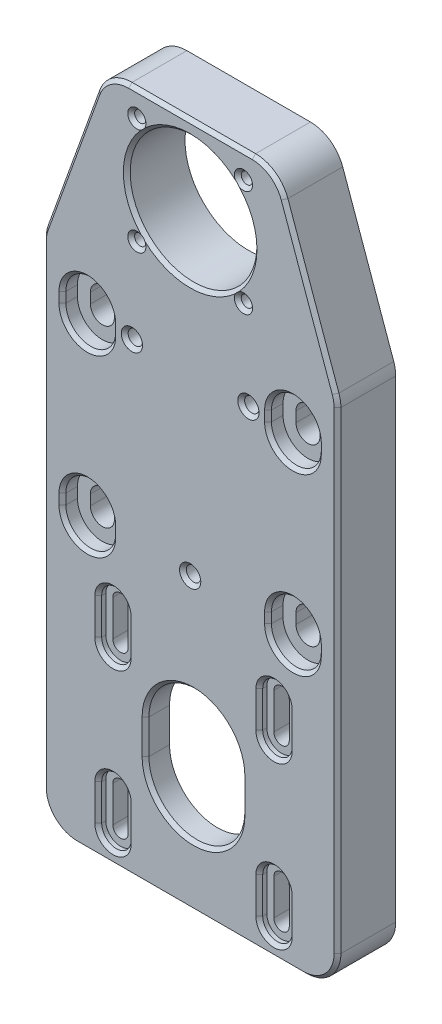
from build123d import *

# Parameters (mm, degrees)
SKETCH1_R                                = 18.5
SKETCH1_W                                = 86
SKETCH1_H                                = 77
SKETCH1_H_2                              = 72.733642247
BOSS_EXTRUDE1_DEPTH                      = 17
M4X0_7_TAPPED_HOLE1_D                    = 3.3
M4X0_7_TAPPED_HOLE1_DEPTH                = 20
M4X0_7_TAPPED_HOLE1_TIP                  = 0.991420021
CBORE_SLOT_FOR_M4_SBHCS3_DEPTH           = 17
CBORE_START                              = 14.8
CBORE_SLOT_FOR_M4_SBHCS3_2_DEPTH         = 2.2
CUT_EXTRUDE1_DEPTH                       = 138.03649149
CBORE_SLOT_FOR_M6_HEX_HEAD_BOLT1_DEPTH   = 17
CBORE_START_2                            = 12.62
CBORE_SLOT_FOR_M6_HEX_HEAD_BOLT1_2_DEPTH = 4.38
FILLET1_R                                = 10
CUT_EXTRUDE2_DEPTH                       = 10
SKETCH22_R                               = 2.1
CUT_EXTRUDE3_DEPTH                       = 138.03649149
CHAMFER1_SIZE                            = 1


# Read off the part's stored shape, not the designer's step: CBORE SLOT for M4 SBHCS3, CBORE SLOT for M6 Hex Head Bolt1
with BuildPart() as part:
    # Sketch1 → Boss-Extrude1 (new body)
    # profile 1 of 3: a face of its own
    with BuildSketch(Plane.XY):
        Polygon((14.773286703, 129), (-14.773286703, 129), (-24.97132573, 129), (-43, 79), (43, 79), (25.15845151, 129), (20.15845151, 129), align=None)
        with Locations((0, 106)):
            Circle(SKETCH1_R, mode=Mode.SUBTRACT)
    # profile 2 of 3: a face of its own
    with BuildSketch(Plane.XY):
        with Locations((0, 40.5)):
            Rectangle(SKETCH1_W, SKETCH1_H)
    # profile 3 of 3: a face of its own
    with BuildSketch(Plane.XY):
        with Locations((0, -34.366821124)):
            Rectangle(SKETCH1_W, SKETCH1_H_2)
    extrude(amount=BOSS_EXTRUDE1_DEPTH)

    # M4x0.7 Tapped Hole1
    with Locations(Plane(origin=(-15.556349182, 90.443650818, 17), x_dir=(1, 0, 0), z_dir=(0, 0, 1))):
        with Locations((0, 0), (0, 31.112698364), (31.112698364, 31.112698364), (31.112698364, 0)):
            Hole(M4X0_7_TAPPED_HOLE1_D / 2, depth=M4X0_7_TAPPED_HOLE1_DEPTH)
            with Locations((0, 0, -(M4X0_7_TAPPED_HOLE1_DEPTH + M4X0_7_TAPPED_HOLE1_TIP / 2))):  # 118° drill point
                Cone(0, M4X0_7_TAPPED_HOLE1_D / 2, M4X0_7_TAPPED_HOLE1_TIP, mode=Mode.SUBTRACT)

    # CBORE SLOT for M4 SBHCS3 outline → CBORE SLOT for M4 SBHCS3 (cut)
    with BuildSketch(Plane.XY):
        with BuildLine():
            ThreePointArc((-20.274967442, -52.200025), (-22.524967442, -49.950025), (-24.774967442, -52.200025))
            Line((-24.774967442, -52.200025), (-24.774967442, -62.700025))
            ThreePointArc((-24.774967442, -62.700025), (-22.524967442, -64.950025), (-20.274967442, -62.700025))
            Line((-20.274967442, -62.700025), (-20.274967442, -52.200025))
        make_face()
        with BuildLine():
            ThreePointArc((-20.274967442, -5.200025), (-22.524967442, -2.950025), (-24.774967442, -5.200025))
            Line((-24.774967442, -5.200025), (-24.774967442, -15.700025))
            ThreePointArc((-24.774967442, -15.700025), (-22.524967442, -17.950025), (-20.274967442, -15.700025))
            Line((-20.274967442, -15.700025), (-20.274967442, -5.200025))
        make_face()
        with BuildLine():
            ThreePointArc((22.225032558, -62.700025), (24.475032558, -64.950025), (26.725032558, -62.700025))
            Line((26.725032558, -62.700025), (26.725032558, -52.200025))
            ThreePointArc((26.725032558, -52.200025), (24.475032558, -49.950025), (22.225032558, -52.200025))
            Line((22.225032558, -52.200025), (22.225032558, -62.700025))
        make_face()
        with BuildLine():
            ThreePointArc((22.225032558, -15.700025), (24.475032558, -17.950025), (26.725032558, -15.700025))
            Line((26.725032558, -15.700025), (26.725032558, -5.200025))
            ThreePointArc((26.725032558, -5.200025), (24.475032558, -2.950025), (22.225032558, -5.200025))
            Line((22.225032558, -5.200025), (22.225032558, -15.700025))
        make_face()
    extrude(amount=CBORE_SLOT_FOR_M4_SBHCS3_DEPTH, mode=Mode.SUBTRACT)

    # CBORE SLOT for M4 SBHCS3 2 outline → CBORE SLOT for M4 SBHCS3 2 (cut)
    # profile 1 of 4: a face of its own
    with BuildSketch(Plane.XY.offset(CBORE_START)):
        with BuildLine():
            Line((-18.224967442, -62.700025), (-18.224967442, -52.200025))
            ThreePointArc((-18.224967442, -52.200025), (-22.524967442, -47.900025), (-26.824967442, -52.200025))
            Line((-26.824967442, -52.200025), (-26.824967442, -62.700025))
            ThreePointArc((-26.824967442, -62.700025), (-22.524967442, -67.000025), (-18.224967442, -62.700025))
        make_face()
        with BuildLine():
            Line((-24.774967442, -62.700025), (-24.774967442, -52.200025))
            ThreePointArc((-24.774967442, -52.200025), (-22.524967442, -49.950025), (-20.274967442, -52.200025))
            Line((-20.274967442, -52.200025), (-20.274967442, -62.700025))
            ThreePointArc((-20.274967442, -62.700025), (-22.524967442, -64.950025), (-24.774967442, -62.700025))
        make_face(mode=Mode.SUBTRACT)
    # profile 2 of 4: a face of its own
    with BuildSketch(Plane.XY.offset(CBORE_START)):
        with BuildLine():
            ThreePointArc((-18.224967442, -5.200025), (-22.524967442, -0.900025), (-26.824967442, -5.200025))
            Line((-26.824967442, -5.200025), (-26.824967442, -15.700025))
            ThreePointArc((-26.824967442, -15.700025), (-22.524967442, -20.000025), (-18.224967442, -15.700025))
            Line((-18.224967442, -15.700025), (-18.224967442, -5.200025))
        make_face()
        with BuildLine():
            Line((-24.774967442, -15.700025), (-24.774967442, -5.200025))
            ThreePointArc((-24.774967442, -5.200025), (-22.524967442, -2.950025), (-20.274967442, -5.200025))
            Line((-20.274967442, -5.200025), (-20.274967442, -15.700025))
            ThreePointArc((-20.274967442, -15.700025), (-22.524967442, -17.950025), (-24.774967442, -15.700025))
        make_face(mode=Mode.SUBTRACT)
    # profile 3 of 4: a face of its own
    with BuildSketch(Plane.XY.offset(CBORE_START)):
        with BuildLine():
            Line((28.775032558, -62.700025), (28.775032558, -52.200025))
            ThreePointArc((28.775032558, -52.200025), (24.475032558, -47.900025), (20.175032558, -52.200025))
            Line((20.175032558, -52.200025), (20.175032558, -62.700025))
            ThreePointArc((20.175032558, -62.700025), (24.475032558, -67.000025), (28.775032558, -62.700025))
        make_face()
        with BuildLine():
            Line((26.725032558, -52.200025), (26.725032558, -62.700025))
            ThreePointArc((26.725032558, -62.700025), (24.475032558, -64.950025), (22.225032558, -62.700025))
            Line((22.225032558, -62.700025), (22.225032558, -52.200025))
            ThreePointArc((22.225032558, -52.200025), (24.475032558, -49.950025), (26.725032558, -52.200025))
        make_face(mode=Mode.SUBTRACT)
    # profile 4 of 4: a face of its own
    with BuildSketch(Plane.XY.offset(CBORE_START)):
        with BuildLine():
            ThreePointArc((28.775032558, -5.200025), (24.475032558, -0.900025), (20.175032558, -5.200025))
            Line((20.175032558, -5.200025), (20.175032558, -15.700025))
            ThreePointArc((20.175032558, -15.700025), (24.475032558, -20.000025), (28.775032558, -15.700025))
            Line((28.775032558, -15.700025), (28.775032558, -5.200025))
        make_face()
        with BuildLine():
            Line((26.725032558, -5.200025), (26.725032558, -15.700025))
            ThreePointArc((26.725032558, -15.700025), (24.475032558, -17.950025), (22.225032558, -15.700025))
            Line((22.225032558, -15.700025), (22.225032558, -5.200025))
            ThreePointArc((22.225032558, -5.200025), (24.475032558, -2.950025), (26.725032558, -5.200025))
        make_face(mode=Mode.SUBTRACT)
    extrude(amount=CBORE_SLOT_FOR_M4_SBHCS3_2_DEPTH, mode=Mode.SUBTRACT)

    # Sketch13 → Cut-Extrude1 (cut, through all)
    with BuildSketch(Plane.XY.offset(17)):
        with BuildLine():
            Line((14.975032558, -28.950025), (14.975032558, -38.950025))
            ThreePointArc((14.975032558, -38.950025), (0.975032558, -52.950025), (-13.024967442, -38.950025))
            Line((-13.024967442, -38.950025), (-13.024967442, -28.950025))
            ThreePointArc((-13.024967442, -28.950025), (0.975032558, -14.950025), (14.975032558, -28.950025))
        make_face()
    extrude(amount=-CUT_EXTRUDE1_DEPTH, mode=Mode.SUBTRACT)

    # CBORE SLOT for M6 Hex Head Bolt1 outline → CBORE SLOT for M6 Hex Head Bolt1 (cut)
    with BuildSketch(Plane.XY):
        with BuildLine():
            ThreePointArc((33.5, 15.5), (30, 19), (26.5, 15.5))
            Line((26.5, 15.5), (26.5, 12.5))
            ThreePointArc((26.5, 12.5), (30, 9), (33.5, 12.5))
            Line((33.5, 12.5), (33.5, 15.5))
        make_face()
        with BuildLine():
            ThreePointArc((33.5, 66.5), (30, 70), (26.5, 66.5))
            Line((26.5, 66.5), (26.5, 63.5))
            ThreePointArc((26.5, 63.5), (30, 60), (33.5, 63.5))
            Line((33.5, 63.5), (33.5, 66.5))
        make_face()
        with BuildLine():
            ThreePointArc((-26.5, 15.5), (-30, 19), (-33.5, 15.5))
            Line((-33.5, 15.5), (-33.5, 12.5))
            ThreePointArc((-33.5, 12.5), (-30, 9), (-26.5, 12.5))
            Line((-26.5, 12.5), (-26.5, 15.5))
        make_face()
        with BuildLine():
            ThreePointArc((-26.5, 66.5), (-30, 70), (-33.5, 66.5))
            Line((-33.5, 66.5), (-33.5, 63.5))
            ThreePointArc((-33.5, 63.5), (-30, 60), (-26.5, 63.5))
            Line((-26.5, 63.5), (-26.5, 66.5))
        make_face()
    extrude(amount=CBORE_SLOT_FOR_M6_HEX_HEAD_BOLT1_DEPTH, mode=Mode.SUBTRACT)

    # CBORE SLOT for M6 Hex Head Bolt1 2 outli → CBORE SLOT for M6 Hex Head Bolt1 2 (cut)
    # profile 1 of 4: a face of its own
    with BuildSketch(Plane.XY.offset(CBORE_START_2)):
        with BuildLine():
            Line((37.275, 12.5), (37.275, 15.5))
            ThreePointArc((37.275, 15.5), (30, 22.775), (22.725, 15.5))
            Line((22.725, 15.5), (22.725, 12.5))
            ThreePointArc((22.725, 12.5), (30, 5.225), (37.275, 12.5))
        make_face()
        with BuildLine():
            Line((26.5, 12.5), (26.5, 15.5))
            ThreePointArc((26.5, 15.5), (30, 19), (33.5, 15.5))
            Line((33.5, 15.5), (33.5, 12.5))
            ThreePointArc((33.5, 12.5), (30, 9), (26.5, 12.5))
        make_face(mode=Mode.SUBTRACT)
    # profile 2 of 4: a face of its own
    with BuildSketch(Plane.XY.offset(CBORE_START_2)):
        with BuildLine():
            ThreePointArc((37.275, 66.5), (30, 73.775), (22.725, 66.5))
            Line((22.725, 66.5), (22.725, 63.5))
            ThreePointArc((22.725, 63.5), (30, 56.225), (37.275, 63.5))
            Line((37.275, 63.5), (37.275, 66.5))
        make_face()
        with BuildLine():
            Line((26.5, 63.5), (26.5, 66.5))
            ThreePointArc((26.5, 66.5), (30, 70), (33.5, 66.5))
            Line((33.5, 66.5), (33.5, 63.5))
            ThreePointArc((33.5, 63.5), (30, 60), (26.5, 63.5))
        make_face(mode=Mode.SUBTRACT)
    # profile 3 of 4: a face of its own
    with BuildSketch(Plane.XY.offset(CBORE_START_2)):
        with BuildLine():
            Line((-22.725, 12.5), (-22.725, 15.5))
            ThreePointArc((-22.725, 15.5), (-30, 22.775), (-37.275, 15.5))
            Line((-37.275, 15.5), (-37.275, 12.5))
            ThreePointArc((-37.275, 12.5), (-30, 5.225), (-22.725, 12.5))
        make_face()
        with BuildLine():
            Line((-33.5, 12.5), (-33.5, 15.5))
            ThreePointArc((-33.5, 15.5), (-30, 19), (-26.5, 15.5))
            Line((-26.5, 15.5), (-26.5, 12.5))
            ThreePointArc((-26.5, 12.5), (-30, 9), (-33.5, 12.5))
        make_face(mode=Mode.SUBTRACT)
    # profile 4 of 4: a face of its own
    with BuildSketch(Plane.XY.offset(CBORE_START_2)):
        with BuildLine():
            ThreePointArc((-22.725, 66.5), (-30, 73.775), (-37.275, 66.5))
            Line((-37.275, 66.5), (-37.275, 63.5))
            ThreePointArc((-37.275, 63.5), (-30, 56.225), (-22.725, 63.5))
            Line((-22.725, 63.5), (-22.725, 66.5))
        make_face()
        with BuildLine():
            Line((-33.5, 63.5), (-33.5, 66.5))
            ThreePointArc((-33.5, 66.5), (-30, 70), (-26.5, 66.5))
            Line((-26.5, 66.5), (-26.5, 63.5))
            ThreePointArc((-26.5, 63.5), (-30, 60), (-33.5, 63.5))
        make_face(mode=Mode.SUBTRACT)
    extrude(amount=CBORE_SLOT_FOR_M6_HEX_HEAD_BOLT1_2_DEPTH, mode=Mode.SUBTRACT)

    # Fillet1
    fillet1_edges = [part.edges().sort_by_distance(p)[0] for p in [
        (-43, 79, 8.5),
        (-24.97132573, 129, 8.5),
        (25.15845151, 129, 8.5),
        (43, 79, 8.5),
        (43, -70.733642247, 8.5),
        (-43, -70.733642247, 8.5),
    ]]
    fillet(fillet1_edges, radius=FILLET1_R)

    # Sketch21 → Cut-Extrude2 (cut)
    with BuildSketch(Plane(origin=(0, 0, 0), x_dir=(-1, 0, 0), z_dir=(0, 0, -1))):
        with BuildLine():
            Line((-31.475032558, -1.050025), (-31.475032558, -8.950025))
            Line((-31.475032558, -8.950025), (-31.475032558, -58.950025))
            Line((-31.475032558, -58.950025), (-31.475032558, -66.850025))
            ThreePointArc((-31.475032558, -66.850025), (-30.859956799, -68.33494924), (-29.375032558, -68.950025))
            Line((-29.375032558, -68.950025), (27.424967442, -68.950025))
            ThreePointArc((27.424967442, -68.950025), (28.909891682, -68.33494924), (29.524967442, -66.850025))
            Line((29.524967442, -66.850025), (29.524967442, -58.950025))
            Line((29.524967442, -58.950025), (29.524967442, -8.950025))
            Line((29.524967442, -8.950025), (29.524967442, -1.050025))
            ThreePointArc((29.524967442, -1.050025), (28.909891682, 0.43489924), (27.424967442, 1.049975))
            Line((27.424967442, 1.049975), (-29.375032558, 1.049975))
            ThreePointArc((-29.375032558, 1.049975), (-30.859956799, 0.43489924), (-31.475032558, -1.050025))
        make_face()
    extrude(amount=-CUT_EXTRUDE2_DEPTH, mode=Mode.SUBTRACT)

    # Sketch22 → Cut-Extrude3 (cut, through all)
    with BuildSketch(Plane.XY.offset(17)):
        with Locations((0, 13.760699385)):
            Circle(SKETCH22_R)
        with Locations((-17, 65)):
            Circle(SKETCH22_R)
        with Locations((17, 65)):
            Circle(SKETCH22_R)
    extrude(amount=-CUT_EXTRUDE3_DEPTH, mode=Mode.SUBTRACT)

    # Chamfer1
    # the kernel refuses this chamfer: 1 mm, written as the material it takes off along each edge
    with BuildSketch(Plane(origin=(28.775032558, -15.700025, 17), x_dir=(0.9996219169112968, 0, 0.027495876610585647), z_dir=(0, 1, 0)), Plane(origin=(20.175032558, -5.200025, 17), x_dir=(-0.9996219169112968, 0, 0.027495876610585647), z_dir=(0, -1, 0)), Plane(origin=(-18.224967442, -15.700025, 17), x_dir=(0.9996219169112968, 0, 0.027495876610585647), z_dir=(0, 1, 0)), Plane(origin=(-26.824967442, -5.200025, 17), x_dir=(-0.9996219169112968, 0, 0.027495876610585647), z_dir=(0, -1, 0)), Plane(origin=(-18.224967442, -62.700025, 17), x_dir=(0.9996219169112968, 0, 0.027495876610585647), z_dir=(0, 1, 0)), Plane(origin=(-26.824967442, -52.200025, 17), x_dir=(-0.9996219169112968, 0, 0.027495876610585647), z_dir=(0, -1, 0)), Plane(origin=(28.775032558, -62.700025, 17), x_dir=(0.9996219169112968, 0, 0.027495876610585647), z_dir=(0, 1, 0)), Plane(origin=(20.175032558, -52.200025, 17), x_dir=(-0.9996219169112968, 0, 0.027495876610585647), z_dir=(0, -1, 0))) as chamfer1_piece_1:
        Polygon((CHAMFER1_SIZE * 0.999621916911, CHAMFER1_SIZE * 0.0274958766106), (-CHAMFER1_SIZE * 0.0274958766106, CHAMFER1_SIZE * 0.999621916911), (0, 0), align=None)
    extrude(amount=10.5, mode=Mode.SUBTRACT)
    with BuildSketch(Plane(origin=(24.475032558, -5.200025, 17), x_dir=(1, 0, 0), z_dir=(0, -1, 0))) as chamfer1_piece_2:
        Polygon((4.3 + CHAMFER1_SIZE, 0), (4.3, -CHAMFER1_SIZE), (4.3, 0), align=None)
    revolve(axis=Axis((24.475032558, -5.200025, 17), (0, 0, 1)), revolution_arc=180, mode=Mode.SUBTRACT)
    with BuildSketch(Plane(origin=(24.475032558, -15.700025, 17), x_dir=(-1, 0, 0), z_dir=(0, 1, 0))) as chamfer1_piece_3:
        Polygon((4.3 + CHAMFER1_SIZE, 0), (4.3, -CHAMFER1_SIZE), (4.3, 0), align=None)
    revolve(axis=Axis((24.475032558, -15.700025, 17), (0, 0, 1)), revolution_arc=180, mode=Mode.SUBTRACT)
    with BuildSketch(Plane(origin=(-22.524967442, -5.200025, 17), x_dir=(1, 0, 0), z_dir=(0, -1, 0))) as chamfer1_piece_4:
        Polygon((4.3 + CHAMFER1_SIZE, 0), (4.3, -CHAMFER1_SIZE), (4.3, 0), align=None)
    revolve(axis=Axis((-22.524967442, -5.200025, 17), (0, 0, 1)), revolution_arc=180, mode=Mode.SUBTRACT)
    with BuildSketch(Plane(origin=(-22.524967442, -15.700025, 17), x_dir=(-1, 0, 0), z_dir=(0, 1, 0))) as chamfer1_piece_5:
        Polygon((4.3 + CHAMFER1_SIZE, 0), (4.3, -CHAMFER1_SIZE), (4.3, 0), align=None)
    revolve(axis=Axis((-22.524967442, -15.700025, 17), (0, 0, 1)), revolution_arc=180, mode=Mode.SUBTRACT)
    with BuildSketch(Plane(origin=(0.975032558, -28.950025, 17), x_dir=(-1, 0, 0), z_dir=(0, -1, 0))) as chamfer1_piece_6:
        Polygon((14 + CHAMFER1_SIZE, 0), (14, CHAMFER1_SIZE), (14, 0), align=None)
    revolve(axis=Axis((0.975032558, -28.950025, 17), (0, 0, -1)), revolution_arc=180, mode=Mode.SUBTRACT)
    with BuildSketch(Plane(origin=(-13.024967442, -38.950025, 17), x_dir=(-0.9996219169112968, 0, 0.027495876610585647), z_dir=(0, 1, 0)), Plane(origin=(14.975032558, -28.950025, 17), x_dir=(0.9996219169112968, 0, 0.027495876610585647), z_dir=(0, -1, 0))) as chamfer1_piece_7:
        Polygon((CHAMFER1_SIZE * 0.999621916911, -CHAMFER1_SIZE * 0.0274958766106), (-CHAMFER1_SIZE * 0.0274958766106, -CHAMFER1_SIZE * 0.999621916911), (0, 0), align=None)
    extrude(amount=10, mode=Mode.SUBTRACT)
    with BuildSketch(Plane(origin=(0.975032558, -38.950025, 17), x_dir=(1, 0, 0), z_dir=(0, 1, 0))) as chamfer1_piece_8:
        Polygon((14 + CHAMFER1_SIZE, 0), (14, CHAMFER1_SIZE), (14, 0), align=None)
    revolve(axis=Axis((0.975032558, -38.950025, 17), (0, 0, -1)), revolution_arc=180, mode=Mode.SUBTRACT)
    with BuildSketch(Plane(origin=(37.275, 12.5, 17), x_dir=(0.9996219169112968, 0, 0.02749587661058555), z_dir=(0, 1, 0)), Plane(origin=(22.725, 15.5, 17), x_dir=(-0.9996219169112968, 0, 0.027495876610585647), z_dir=(0, -1, 0)), Plane(origin=(-22.725, 12.5, 17), x_dir=(0.9996219169112968, 0, 0.027495876610585647), z_dir=(0, 1, 0)), Plane(origin=(-37.275, 15.5, 17), x_dir=(-0.9996219169112968, 0, 0.02749587661058555), z_dir=(0, -1, 0)), Plane(origin=(-22.725, 63.5, 17), x_dir=(0.9996219169112968, 0, 0.027495876610585647), z_dir=(0, 1, 0)), Plane(origin=(-37.275, 66.5, 17), x_dir=(-0.9996219169112968, 0, 0.02749587661058555), z_dir=(0, -1, 0)), Plane(origin=(37.275, 63.5, 17), x_dir=(0.9996219169112968, 0, 0.02749587661058555), z_dir=(0, 1, 0)), Plane(origin=(22.725, 66.5, 17), x_dir=(-0.9996219169112968, 0, 0.027495876610585647), z_dir=(0, -1, 0))) as chamfer1_piece_9:
        Polygon((CHAMFER1_SIZE * 0.999621916911, CHAMFER1_SIZE * 0.0274958766106), (-CHAMFER1_SIZE * 0.0274958766106, CHAMFER1_SIZE * 0.999621916911), (0, 0), align=None)
    extrude(amount=3, mode=Mode.SUBTRACT)
    with BuildSketch(Plane(origin=(30, 15.5, 17), x_dir=(1, 0, 0), z_dir=(0, -1, 0))) as chamfer1_piece_10:
        Polygon((7.275 + CHAMFER1_SIZE, 0), (7.275, -CHAMFER1_SIZE), (7.275, 0), align=None)
    revolve(axis=Axis((30, 15.5, 17), (0, 0, 1)), revolution_arc=180, mode=Mode.SUBTRACT)
    with BuildSketch(Plane(origin=(30, 12.5, 17), x_dir=(-1, 0, 0), z_dir=(0, 1, 0))) as chamfer1_piece_11:
        Polygon((7.275 + CHAMFER1_SIZE, 0), (7.275, -CHAMFER1_SIZE), (7.275, 0), align=None)
    revolve(axis=Axis((30, 12.5, 17), (0, 0, 1)), revolution_arc=180, mode=Mode.SUBTRACT)
    with BuildSketch(Plane(origin=(-30, 15.5, 17), x_dir=(1, 0, 0), z_dir=(0, -1, 0))) as chamfer1_piece_12:
        Polygon((7.275 + CHAMFER1_SIZE, 0), (7.275, -CHAMFER1_SIZE), (7.275, 0), align=None)
    revolve(axis=Axis((-30, 15.5, 17), (0, 0, 1)), revolution_arc=180, mode=Mode.SUBTRACT)
    with BuildSketch(Plane(origin=(-30, 12.5, 17), x_dir=(-1, 0, 0), z_dir=(0, 1, 0))) as chamfer1_piece_13:
        Polygon((7.275 + CHAMFER1_SIZE, 0), (7.275, -CHAMFER1_SIZE), (7.275, 0), align=None)
    revolve(axis=Axis((-30, 12.5, 17), (0, 0, 1)), revolution_arc=180, mode=Mode.SUBTRACT)
    with BuildSketch(Plane(origin=(-30, 66.5, 17), x_dir=(1, 0, 0), z_dir=(0, -1, 0))) as chamfer1_piece_14:
        Polygon((7.275 + CHAMFER1_SIZE, 0), (7.275, -CHAMFER1_SIZE), (7.275, 0), align=None)
    revolve(axis=Axis((-30, 66.5, 17), (0, 0, 1)), revolution_arc=180, mode=Mode.SUBTRACT)
    with BuildSketch(Plane(origin=(-30, 63.5, 17), x_dir=(-1, 0, 0), z_dir=(0, 1, 0))) as chamfer1_piece_15:
        Polygon((7.275 + CHAMFER1_SIZE, 0), (7.275, -CHAMFER1_SIZE), (7.275, 0), align=None)
    revolve(axis=Axis((-30, 63.5, 17), (0, 0, 1)), revolution_arc=180, mode=Mode.SUBTRACT)
    with BuildSketch(Plane(origin=(30, 66.5, 17), x_dir=(1, 0, 0), z_dir=(0, -1, 0))) as chamfer1_piece_16:
        Polygon((7.275 + CHAMFER1_SIZE, 0), (7.275, -CHAMFER1_SIZE), (7.275, 0), align=None)
    revolve(axis=Axis((30, 66.5, 17), (0, 0, 1)), revolution_arc=180, mode=Mode.SUBTRACT)
    with BuildSketch(Plane(origin=(30, 63.5, 17), x_dir=(-1, 0, 0), z_dir=(0, 1, 0))) as chamfer1_piece_17:
        Polygon((7.275 + CHAMFER1_SIZE, 0), (7.275, -CHAMFER1_SIZE), (7.275, 0), align=None)
    revolve(axis=Axis((30, 63.5, 17), (0, 0, 1)), revolution_arc=180, mode=Mode.SUBTRACT)
    with BuildSketch(Plane(origin=(42.418349174, 80.630045807, 17), x_dir=(-0.9414788255482561, -0.33594880236978336, 0.027495876610585532), z_dir=(-0.3360758669716067, 0.9418349174028764, 0))) as chamfer1_piece_18:
        Polygon((CHAMFER1_SIZE * 0.999621916911, -CHAMFER1_SIZE * 0.0274958766106), (-CHAMFER1_SIZE * 0.0274958766106, -CHAMFER1_SIZE * 0.999621916911), (0, 0), align=None)
    extrude(amount=44.307884633, mode=Mode.SUBTRACT)
    with BuildSketch(Plane(origin=(15.556349182, 90.443650818, 17), x_dir=(-1, 0, 0), z_dir=(0, -1, 0))) as chamfer1_piece_19:
        Polygon((1.65 + CHAMFER1_SIZE, 0), (1.65, CHAMFER1_SIZE), (1.65, 0), align=None)
    revolve(axis=Axis((15.556349182, 90.443650818, 17), (0, 0, -1)), mode=Mode.SUBTRACT)
    with BuildSketch(Plane(origin=(43, -60.733642247, 17), x_dir=(-0.9996219169112968, 0, 0.02749587661058555), z_dir=(0, 1, 0))) as chamfer1_piece_20:
        Polygon((CHAMFER1_SIZE * 0.999621916911, -CHAMFER1_SIZE * 0.0274958766106), (-CHAMFER1_SIZE * 0.0274958766106, -CHAMFER1_SIZE * 0.999621916911), (0, 0), align=None)
    extrude(amount=138.002929384, mode=Mode.SUBTRACT)
    with BuildSketch(Plane(origin=(-43, 77.25220626, 17), x_dir=(0.9996219169112968, 0, 0.02749587661058555), z_dir=(0, -1, 0))) as chamfer1_piece_21:
        Polygon((CHAMFER1_SIZE * 0.999621916911, -CHAMFER1_SIZE * 0.0274958766106), (-CHAMFER1_SIZE * 0.0274958766106, -CHAMFER1_SIZE * 0.999621916911), (0, 0), align=None)
    extrude(amount=137.985848507, mode=Mode.SUBTRACT)
    with BuildSketch(Plane(origin=(-33, -70.733642247, 17), x_dir=(0, 0.9996219169112968, 0.02749587661058574), z_dir=(1, 0, 0))) as chamfer1_piece_22:
        Polygon((CHAMFER1_SIZE * 0.999621916911, -CHAMFER1_SIZE * 0.0274958766106), (-CHAMFER1_SIZE * 0.0274958766106, -CHAMFER1_SIZE * 0.999621916911), (0, 0), align=None)
    extrude(amount=66, mode=Mode.SUBTRACT)
    with BuildSketch(Plane(origin=(-17.946852503, 129, 17), x_dir=(0, 0.0274958766105822, -0.999621916911297), z_dir=(1, 0, 0))) as chamfer1_piece_23:
        Polygon((CHAMFER1_SIZE * 0.999621916911, -CHAMFER1_SIZE * 0.0274958766106), (-CHAMFER1_SIZE * 0.0274958766106, -CHAMFER1_SIZE * 0.999621916911), (0, 0), align=None)
    extrude(amount=36.056041762, mode=Mode.SUBTRACT)
    with BuildSketch(Plane(origin=(-27.354006083, 122.391970154, 17), x_dir=(0.9403596894143853, -0.33906877074407227, 0.027495876610585616), z_dir=(-0.3391970153993334, -0.9407153579825219, 0))) as chamfer1_piece_24:
        Polygon((CHAMFER1_SIZE * 0.999621916911, -CHAMFER1_SIZE * 0.0274958766106), (-CHAMFER1_SIZE * 0.0274958766106, -CHAMFER1_SIZE * 0.999621916911), (0, 0), align=None)
    extrude(amount=44.378773436, mode=Mode.SUBTRACT)
    with BuildSketch(Plane(origin=(33, -60.733642247, 17), x_dir=(0, -1, 0), z_dir=(-1, 0, 0))) as chamfer1_piece_25:
        Polygon((10 - CHAMFER1_SIZE, 0), (10, -CHAMFER1_SIZE), (10, 0), align=None)
    revolve(axis=Axis((33, -60.733642247, 17), (0, 0, 1)), revolution_arc=90, mode=Mode.SUBTRACT)
    with BuildSketch(Plane(origin=(-33, -60.733642247, 17), x_dir=(-1, 0, 0), z_dir=(0, 1, 0))) as chamfer1_piece_26:
        Polygon((10 - CHAMFER1_SIZE, 0), (10, -CHAMFER1_SIZE), (10, 0), align=None)
    revolve(axis=Axis((-33, -60.733642247, 17), (0, 0, 1)), revolution_arc=90, mode=Mode.SUBTRACT)
    with BuildSketch(Plane(origin=(-33, 77.25220626, 17), x_dir=(-0.9407153579825221, 0.3391970153993328, 0), z_dir=(0.3391970153993328, 0.9407153579825221, 0))) as chamfer1_piece_27:
        Polygon((10 - CHAMFER1_SIZE, 0), (10, -CHAMFER1_SIZE), (10, 0), align=None)
    revolve(axis=Axis((-33, 77.25220626, 17), (0, 0, 1)), revolution_arc=19.827959469, mode=Mode.SUBTRACT)
    with BuildSketch(Plane(origin=(-17.946852503, 119, 17), x_dir=(0, 1, 0), z_dir=(1, 0, 0))) as chamfer1_piece_28:
        Polygon((10, -CHAMFER1_SIZE), (10 - CHAMFER1_SIZE, 0), (10, 0), align=None)
    revolve(axis=Axis((-17.946852503, 119, 17), (0, 0, 1)), revolution_arc=70.172040531, mode=Mode.SUBTRACT)
    with BuildSketch(Plane(origin=(18.109189258, 119, 17), x_dir=(0, 1, 0), z_dir=(-1, 0, 0))) as chamfer1_piece_29:
        Polygon((10, CHAMFER1_SIZE), (10 - CHAMFER1_SIZE, 0), (10, 0), align=None)
    revolve(axis=Axis((18.109189258, 119, 17), (0, 0, -1)), revolution_arc=70.362025862, mode=Mode.SUBTRACT)
    with BuildSketch(Plane(origin=(33, 77.269287137, 17), x_dir=(0.9418349174028765, 0.3360758669716064, 0), z_dir=(-0.3360758669716064, 0.9418349174028765, 0))) as chamfer1_piece_30:
        Polygon((10 - CHAMFER1_SIZE, 0), (10, CHAMFER1_SIZE), (10, 0), align=None)
    revolve(axis=Axis((33, 77.269287137, 17), (0, 0, -1)), revolution_arc=19.637974138, mode=Mode.SUBTRACT)
    with BuildSketch(Plane(origin=(15.556349182, 121.556349182, 17), x_dir=(-1, 0, 0), z_dir=(0, -1, 0))) as chamfer1_piece_31:
        Polygon((1.65 + CHAMFER1_SIZE, 0), (1.65, CHAMFER1_SIZE), (1.65, 0), align=None)
    revolve(axis=Axis((15.556349182, 121.556349182, 17), (0, 0, -1)), mode=Mode.SUBTRACT)
    with BuildSketch(Plane(origin=(0, 13.760699385, 17), x_dir=(1, 0, 0), z_dir=(0, -1, 0))) as chamfer1_piece_32:
        Polygon((2.1 + CHAMFER1_SIZE, 0), (2.1, -CHAMFER1_SIZE), (2.1, 0), align=None)
    revolve(axis=Axis((0, 13.760699385, 17), (0, 0, 1)), mode=Mode.SUBTRACT)
    with BuildSketch(Plane(origin=(-17, 65, 17), x_dir=(1, 0, 0), z_dir=(0, -1, 0))) as chamfer1_piece_33:
        Polygon((2.1 + CHAMFER1_SIZE, 0), (2.1, -CHAMFER1_SIZE), (2.1, 0), align=None)
    revolve(axis=Axis((-17, 65, 17), (0, 0, 1)), mode=Mode.SUBTRACT)
    with BuildSketch(Plane(origin=(-15.556349182, 121.556349182, 17), x_dir=(-1, 0, 0), z_dir=(0, -1, 0))) as chamfer1_piece_34:
        Polygon((1.65 + CHAMFER1_SIZE, 0), (1.65, CHAMFER1_SIZE), (1.65, 0), align=None)
    revolve(axis=Axis((-15.556349182, 121.556349182, 17), (0, 0, -1)), mode=Mode.SUBTRACT)
    with BuildSketch(Plane(origin=(17, 65, 17), x_dir=(1, 0, 0), z_dir=(0, -1, 0))) as chamfer1_piece_35:
        Polygon((2.1 + CHAMFER1_SIZE, 0), (2.1, -CHAMFER1_SIZE), (2.1, 0), align=None)
    revolve(axis=Axis((17, 65, 17), (0, 0, 1)), mode=Mode.SUBTRACT)
    with BuildSketch(Plane(origin=(-15.556349182, 90.443650818, 17), x_dir=(-1, 0, 0), z_dir=(0, -1, 0))) as chamfer1_piece_36:
        Polygon((1.65 + CHAMFER1_SIZE, 0), (1.65, CHAMFER1_SIZE), (1.65, 0), align=None)
    revolve(axis=Axis((-15.556349182, 90.443650818, 17), (0, 0, -1)), mode=Mode.SUBTRACT)
    with BuildSketch(Plane(origin=(-22.524967442, -52.200025, 17), x_dir=(1, 0, 0), z_dir=(0, -1, 0))) as chamfer1_piece_37:
        Polygon((4.3 + CHAMFER1_SIZE, 0), (4.3, -CHAMFER1_SIZE), (4.3, 0), align=None)
    revolve(axis=Axis((-22.524967442, -52.200025, 17), (0, 0, 1)), revolution_arc=180, mode=Mode.SUBTRACT)
    with BuildSketch(Plane(origin=(-22.524967442, -62.700025, 17), x_dir=(-1, 0, 0), z_dir=(0, 1, 0))) as chamfer1_piece_38:
        Polygon((4.3 + CHAMFER1_SIZE, 0), (4.3, -CHAMFER1_SIZE), (4.3, 0), align=None)
    revolve(axis=Axis((-22.524967442, -62.700025, 17), (0, 0, 1)), revolution_arc=180, mode=Mode.SUBTRACT)
    with BuildSketch(Plane(origin=(0, 106, 17), x_dir=(1, 0, 0), z_dir=(0, -1, 0))) as chamfer1_piece_39:
        Polygon((18.5 + CHAMFER1_SIZE, 0), (18.5, -CHAMFER1_SIZE), (18.5, 0), align=None)
    revolve(axis=Axis((0, 106, 17), (0, 0, 1)), mode=Mode.SUBTRACT)
    with BuildSketch(Plane(origin=(24.475032558, -52.200025, 17), x_dir=(1, 0, 0), z_dir=(0, -1, 0))) as chamfer1_piece_40:
        Polygon((4.3 + CHAMFER1_SIZE, 0), (4.3, -CHAMFER1_SIZE), (4.3, 0), align=None)
    revolve(axis=Axis((24.475032558, -52.200025, 17), (0, 0, 1)), revolution_arc=180, mode=Mode.SUBTRACT)
    with BuildSketch(Plane(origin=(24.475032558, -62.700025, 17), x_dir=(-1, 0, 0), z_dir=(0, 1, 0))) as chamfer1_piece_41:
        Polygon((4.3 + CHAMFER1_SIZE, 0), (4.3, -CHAMFER1_SIZE), (4.3, 0), align=None)
    revolve(axis=Axis((24.475032558, -62.700025, 17), (0, 0, 1)), revolution_arc=180, mode=Mode.SUBTRACT)


solid = part.part
